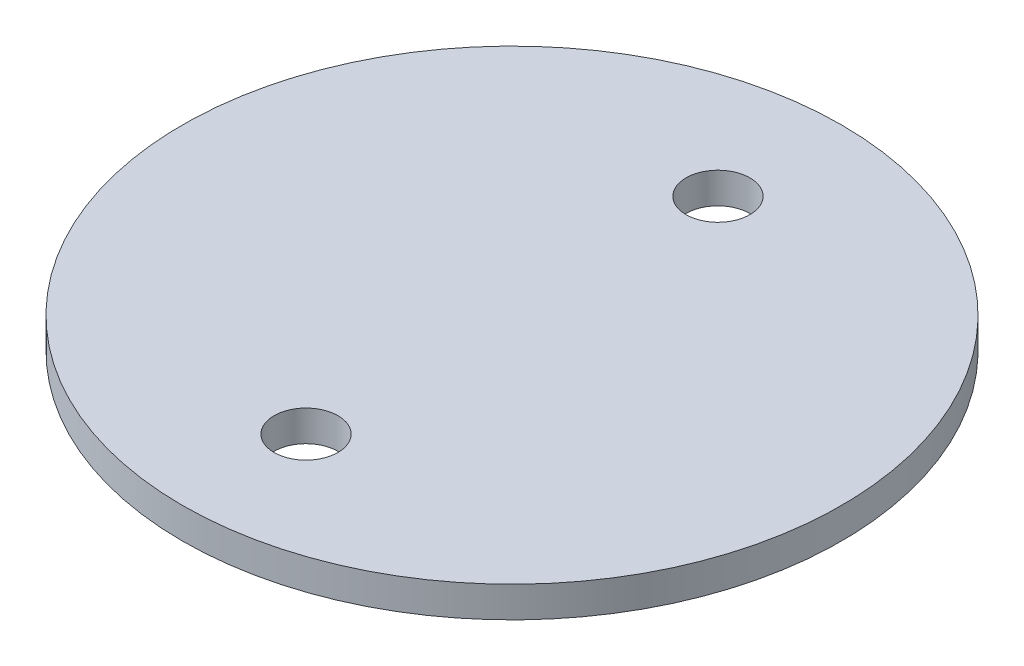
from build123d import *

# Parameters (mm, degrees)
SKETCH1_R           = 32
BOSS_EXTRUDE1_DEPTH = 3


with BuildPart() as part:
    # Sketch1 → Boss-Extrude1 (new body)
    with BuildSketch(Plane(origin=(0, 0, 0), x_dir=(1, 0, 0), z_dir=(0, 1, 0))):
        Circle(SKETCH1_R)
        with BuildLine():
            ThreePointArc((3.1, -20), (-2.192031022, -22.192031022), (0, -16.9))
            ThreePointArc((0, -16.9), (2.192031022, -17.807968978), (3.1, -20))
        make_face(mode=Mode.SUBTRACT)
        with BuildLine():
            ThreePointArc((3.1, 20), (2.192031022, 17.807968978), (0, 16.9))
            ThreePointArc((0, 16.9), (-2.192031022, 22.192031022), (3.1, 20))
        make_face(mode=Mode.SUBTRACT)
    extrude(amount=BOSS_EXTRUDE1_DEPTH)


solid = part.part
